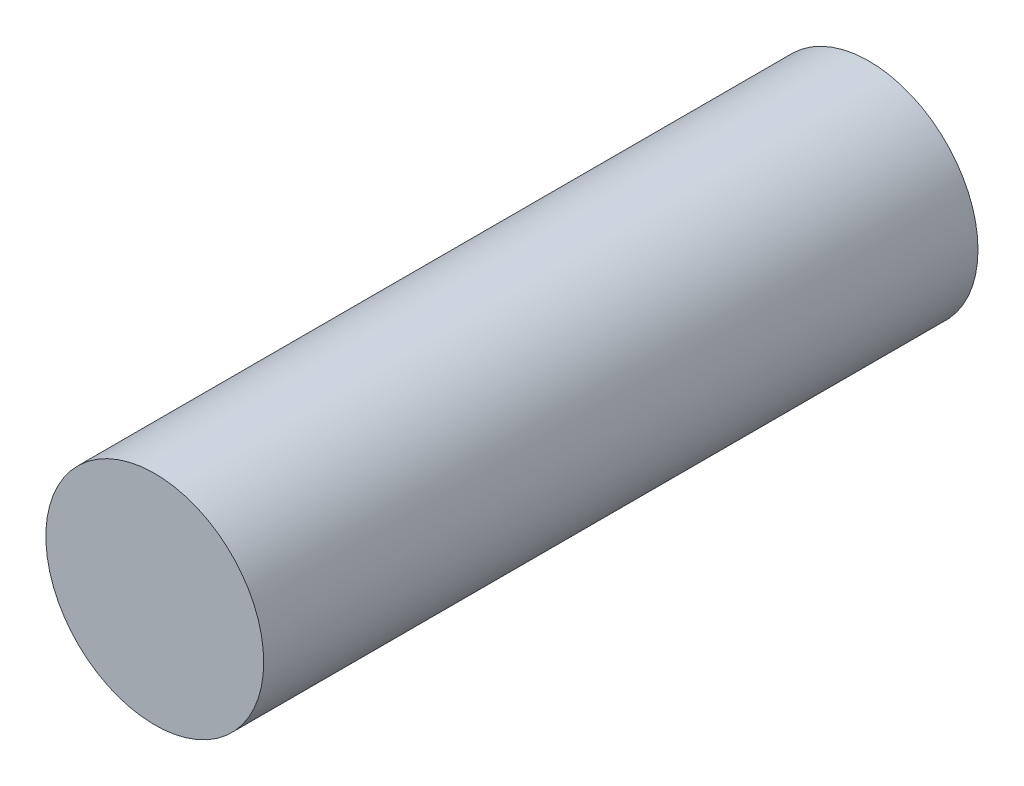
from build123d import *

# Parameters (mm, degrees)
BOSS_EXTRUDE1_DEPTH      = 3
BOSS_EXTRUDE1_DEPTH_BACK = 17
SKETCH1_R                = 3.05


with BuildPart() as part:
    # Sketch1 → Boss-Extrude1 (new, two sides: drawn at the far end of the back side and taken through both)
    with BuildSketch(Plane.XY.offset(-BOSS_EXTRUDE1_DEPTH_BACK)):
        with Locations((8.5, 4)):
            Circle(SKETCH1_R)
    extrude(amount=BOSS_EXTRUDE1_DEPTH + BOSS_EXTRUDE1_DEPTH_BACK)


solid = part.part
